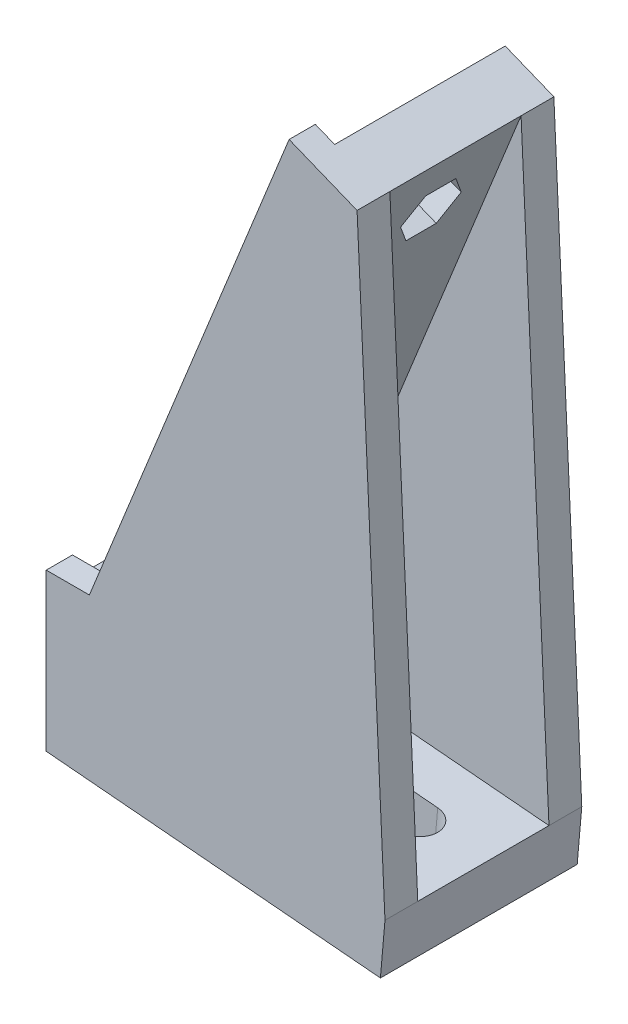
from build123d import *

# Parameters (mm, degrees)
BOSS_EXTRUDE1_DEPTH            = 15
CUT_EXTRUDE1_DEPTH             = 102.502312716
RIB1_REACH                     = 92.198
SKETCH4_WALL_W                 = 274.08141224
SKETCH4_WALL_H                 = 5
M4_CLEARANCE_HOLE1_D           = 4.5
M4_CLEARANCE_HOLE1_CSINK_D     = 4.55
M4_CLEARANCE_HOLE1_CSINK_ANGLE = 90
CUT_EXTRUDE2_DEPTH             = 3
FILLET1_R                      = 10
BOSS_EXTRUDE2_DEPTH            = 4


with BuildPart() as part:
    # Sketch1 → Boss-Extrude1 (new, symmetric)
    with BuildSketch(Plane.XY):
        Polygon((0, 0), (29.968527473, 74.174708365), (37.38599831, 71.177855618), (1.791119352, -16.922561338), (41.638907276, -20.408791048), (40.941661334, -28.378348633), (-10, -23.921530765), (-10, -3.175), (0, -3.175), align=None)
    extrude(amount=BOSS_EXTRUDE1_DEPTH, both=True)

    # Sketch2 → Cut-Extrude1 (cut, through all)
    with BuildSketch(Plane(origin=(-1.077186067, -16.671617131, 0), x_dir=(0.9961946980917449, -0.08715574274766551, 0), z_dir=(0.08715574274766551, 0.9961946980917449, 0))):
        with BuildLine():
            Line((32.87926188, -3), (27.87926188, -3))
            ThreePointArc((27.87926188, -3), (24.87926188, 0), (27.87926188, 3))
            Line((27.87926188, 3), (32.87926188, 3))
            ThreePointArc((32.87926188, 3), (35.87926188, 0), (32.87926188, -3))
        make_face()
    extrude(amount=-CUT_EXTRUDE1_DEPTH, mode=Mode.SUBTRACT)

    # Sketch4 wall → Rib1 (add, up to next)
    with BuildSketch(Plane(origin=(39.512452793, 25.384532285, 15), x_dir=(0.046385922653, -0.998923593765, 0), z_dir=(0.998923593765, 0.046385922653, 0)), mode=Mode.PRIVATE) as rib1_sk1:
        with Locations((0, 2.5)):
            Rectangle(SKETCH4_WALL_W, SKETCH4_WALL_H)
    rib1_tool1 = extrude(rib1_sk1.sketch, amount=-RIB1_REACH, mode=Mode.PRIVATE) - part.part
    rib1 = rib1_tool1.solids().sort_by_distance((39.512452793, 25.384532285, 15))[0]
    add(rib1)

    # Mirror1: Rib1 across plane
    add(rib1.mirror(Plane.XY))

    # M4 Clearance Hole1 (through all)
    with Locations(Plane(origin=(7.417470837, -2.996852747, 0), x_dir=(0, 0, -1), z_dir=(0.9271838545667858, -0.37460659341591607, 0))):
        with Locations((0, 70), (0, 25)):
            CounterSinkHole(M4_CLEARANCE_HOLE1_D / 2, M4_CLEARANCE_HOLE1_CSINK_D / 2, counter_sink_angle=M4_CLEARANCE_HOLE1_CSINK_ANGLE)

    # Sketch8 → Cut-Extrude2 (cut)
    with BuildSketch(Plane(origin=(7.417470837, -2.996852747, 0), x_dir=(0, 0, -1), z_dir=(0.9271838545667858, -0.37460659341591607, 0))):
        Polygon((4.618802154, 70), (2.309401077, 74), (-2.309401077, 74), (-4.618802154, 70), (-2.309401077, 66), (2.309401077, 66), align=None)
        Polygon((4.618802154, 25), (2.309401077, 29), (-2.309401077, 29), (-4.618802154, 25), (-2.309401077, 21), (2.309401077, 21), align=None)
    extrude(amount=-CUT_EXTRUDE2_DEPTH, mode=Mode.SUBTRACT)

    # Fillet1
    fillet1_edges = [part.edges().sort_by_distance(p)[0] for p in [
        (1.791119352, -16.922561338, 0),
    ]]
    fillet(fillet1_edges, radius=FILLET1_R)

    # Sketch11 → Boss-Extrude2 (add)
    with BuildSketch(Plane.XY.offset(15)):
        Polygon((-10, -3.175), (-10, 0), (-3.424347808, 0), (27.024718735, 75.364084299), (29.968527473, 74.174708365), (0, 0), (0, -3.175), align=None)
    extrude(amount=-BOSS_EXTRUDE2_DEPTH)


solid = part.part
